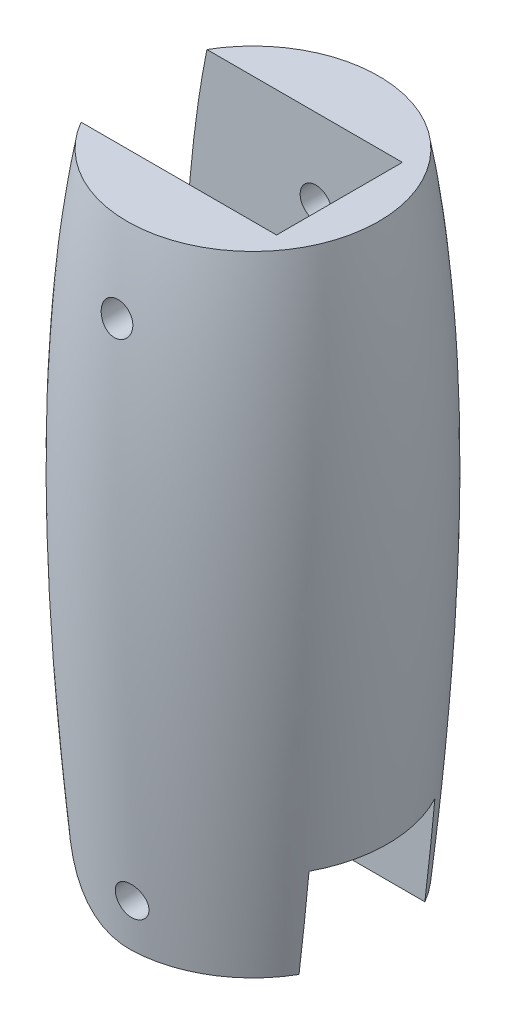
from build123d import *

# Parameters (mm, degrees)
CUT_EXTRUDE1_DEPTH      = 5.5
CUT_EXTRUDE1_DEPTH_BACK = 24.938835821
SKETCH2_W               = 8
SKETCH2_H               = 13
SKETCH2_H_2             = 12
CUT_EXTRUDE2_DEPTH      = 24.938835821
CUT_EXTRUDE2_DEPTH_BACK = 24.938835821
SKETCH3_R               = 1
CUT_EXTRUDE4_START      = 10
CUT_EXTRUDE4_DEPTH      = 20
SKETCH6_R               = 0.5
CUT_EXTRUDE5_DEPTH      = 31.03444459
SKETCH7_W               = 8
SKETCH7_H               = 6
CUT_EXTRUDE6_DEPTH      = 27.563957465


with BuildPart() as part:
    # Sketch1 → Revolve1 (revolve)
    with BuildSketch(Plane(origin=(0, 0, 0), x_dir=(0, 0, -1), z_dir=(1, 0, 0))):
        with BuildLine():
            Line((0, 20), (0, -20))
            Line((0, -20), (8, -20))
            add(Edge.make_bspline(
                [(8, 20), (10.604722665, 5.227883705), (8, -20)],
                knots=[0, 0, 0, 1, 1, 1], degree=2))
            Line((8, 20), (0, 20))
        make_face()
    revolve(axis=Axis((0, 20, 0), (0, -1, 0)))

    # Sketch2 → Cut-Extrude1 (cut, two sides: drawn at the far end of the back side and taken through both)
    with BuildSketch(Plane(origin=(0, 0, 0), x_dir=(0, 0, -1), z_dir=(1, 0, 0)).offset(-CUT_EXTRUDE1_DEPTH_BACK)):
        with Locations((0, 13.5)):
            Rectangle(SKETCH2_W, SKETCH2_H)
        with Locations((0, -14)):
            Rectangle(SKETCH2_W, SKETCH2_H_2)
    extrude(amount=CUT_EXTRUDE1_DEPTH + CUT_EXTRUDE1_DEPTH_BACK, mode=Mode.SUBTRACT)

    # Sketch3 → Cut-Extrude2 (cut, two sides: drawn at the far end of the back side and taken through both)
    with BuildSketch(Plane.XY.offset(-CUT_EXTRUDE2_DEPTH_BACK)):
        with Locations((0, 15)):
            Circle(SKETCH3_R)
        with Locations((0.535898385, -17)):
            Circle(SKETCH3_R)
    extrude(amount=CUT_EXTRUDE2_DEPTH + CUT_EXTRUDE2_DEPTH_BACK, mode=Mode.SUBTRACT)

    # Sketch5 → Cut-Extrude4 (cut)
    with BuildSketch(Plane.XY.offset(CUT_EXTRUDE4_START)):
        with BuildLine():
            add(Edge.make_bspline(
                [(-7.683797501, -12.69281547), (-7.471742946, -15.132228264), (-7.218170916, -17.567798425), (-6.92820323, -20)],
                knots=[0.390461667, 0.390461667, 0.390461667, 0.390461667, 1, 1, 1, 1], degree=3))
            Line((-6.92820323, -20), (0.286146459, -20))
            ThreePointArc((0.286146459, -20), (-5.120214435, -17.896716195), (-7.683797501, -12.69281547))
        make_face()
    extrude(amount=-CUT_EXTRUDE4_DEPTH, mode=Mode.SUBTRACT)

    # Sketch6 → Cut-Extrude5 (cut, through all)
    with BuildSketch(Plane(origin=(0, 7, 0), x_dir=(1, 0, 0), z_dir=(0, 1, 0))):
        with Locations((-3, 0)):
            Circle(SKETCH6_R)
        with Locations((4, 0)):
            Circle(SKETCH6_R)
    extrude(amount=-CUT_EXTRUDE5_DEPTH, mode=Mode.SUBTRACT)

    # Sketch7 → Cut-Extrude6 (cut, through all)
    with BuildSketch(Plane.ZY.offset(-5.5)):
        with Locations((0, -17)):
            Rectangle(SKETCH7_W, SKETCH7_H)
    extrude(amount=-CUT_EXTRUDE6_DEPTH, mode=Mode.SUBTRACT)


solid = part.part
